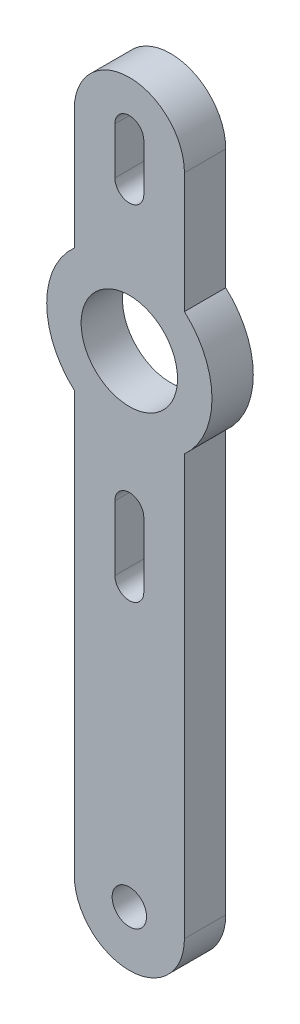
from build123d import *

# Parameters (mm, degrees)
ESQUISSE1_R               = 3.5
ESQUISSE1_R_2             = 1.25
T_LE_DE_BASE_PLI_E1_DEPTH = 3


# Sheet-metal steps are written as plain solids
with BuildPart() as part:
    # Esquisse1 → Tôle de base pliée1 (new body)
    with BuildSketch(Plane.XY):
        with BuildLine():
            Line((312.545394727, 1587.348462935), (312.545394727, 1556.858242671))
            ThreePointArc((312.545394727, 1556.858242671), (316.545394727, 1552.858242671), (320.545394727, 1556.858242671))
            Line((320.545394727, 1556.858242671), (320.545394727, 1587.348462935))
            ThreePointArc((320.545394727, 1587.348462935), (322.545394727, 1591.82059889), (320.545394727, 1596.292734845))
            Line((320.545394727, 1596.292734845), (320.545394727, 1605.02468454))
            ThreePointArc((320.545394727, 1605.02468454), (316.545394727, 1609.02468454), (312.545394727, 1605.02468454))
            Line((312.545394727, 1605.02468454), (312.545394727, 1596.292734845))
            ThreePointArc((312.545394727, 1596.292734845), (310.545394727, 1591.82059889), (312.545394727, 1587.348462935))
        make_face()
        with Locations((316.545394727, 1591.82059889)):
            Circle(ESQUISSE1_R, mode=Mode.SUBTRACT)
        with Locations((316.545394727, 1556.858242671)):
            Circle(ESQUISSE1_R_2, mode=Mode.SUBTRACT)
        with BuildLine():
            Line((315.495394727, 1605.57468454), (315.495394727, 1602.17468454))
            ThreePointArc((315.495394727, 1602.17468454), (316.545394727, 1601.12468454), (317.595394727, 1602.17468454))
            Line((317.595394727, 1602.17468454), (317.595394727, 1605.57468454))
            ThreePointArc((317.595394727, 1605.57468454), (316.545394727, 1606.62468454), (315.495394727, 1605.57468454))
        make_face(mode=Mode.SUBTRACT)
        with BuildLine():
            Line((315.495394727, 1581.87059889), (315.495394727, 1577.17059889))
            ThreePointArc((315.495394727, 1577.17059889), (316.545394727, 1576.12059889), (317.595394727, 1577.17059889))
            Line((317.595394727, 1577.17059889), (317.595394727, 1581.87059889))
            ThreePointArc((317.595394727, 1581.87059889), (316.545394727, 1582.92059889), (315.495394727, 1581.87059889))
        make_face(mode=Mode.SUBTRACT)
    extrude(amount=-T_LE_DE_BASE_PLI_E1_DEPTH)


solid = part.part
